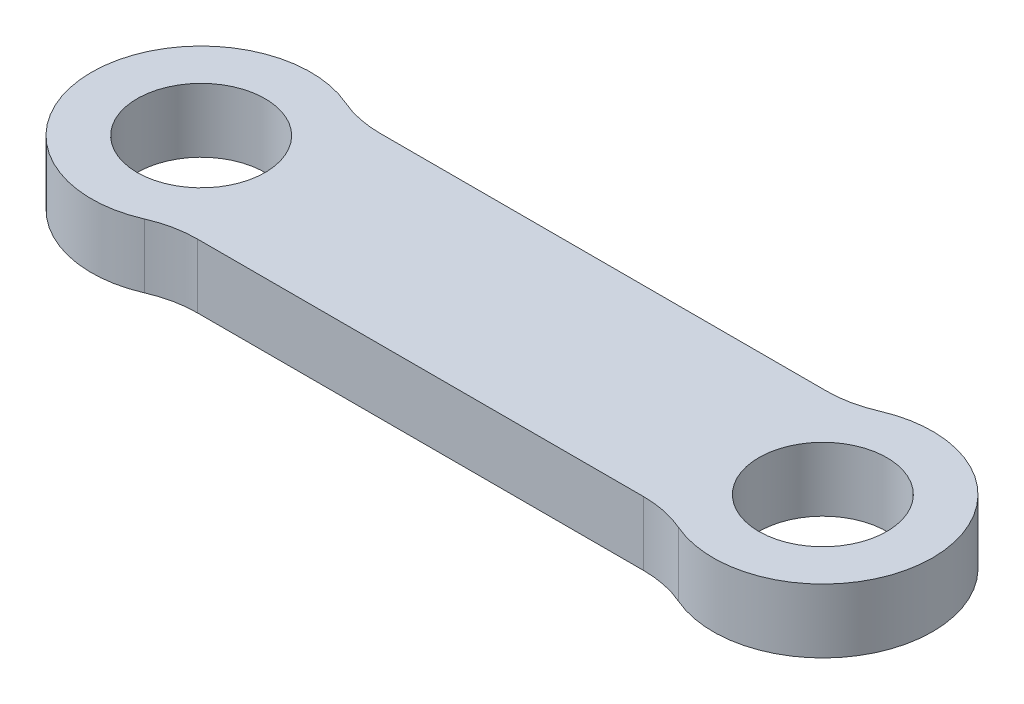
from build123d import *

# Parameters (mm, degrees)
SKETCH1_R           = 1.75
BOSS_EXTRUDE1_DEPTH = 1.75
FILLET1_R           = 3


with BuildPart() as part:
    # Sketch1 → Boss-Extrude1 (new body)
    with BuildSketch(Plane(origin=(0, 0, 0), x_dir=(1, 0, 0), z_dir=(0, 1, 0))):
        with BuildLine():
            ThreePointArc((1.658312395, 2.5), (-3, 0), (1.658312395, -2.5))
            Line((1.658312395, -2.5), (15.341687605, -2.5))
            ThreePointArc((15.341687605, -2.5), (20, 0), (15.341687605, 2.5))
            Line((15.341687605, 2.5), (1.658312395, 2.5))
        make_face()
        Circle(SKETCH1_R, mode=Mode.SUBTRACT)
        with Locations((17, 0)):
            Circle(SKETCH1_R, mode=Mode.SUBTRACT)
    extrude(amount=BOSS_EXTRUDE1_DEPTH)

    # Fillet1
    fillet1_edges = [part.edges().sort_by_distance(p)[0] for p in [
        (1.658312395, 0.875, 2.5),
        (15.341687605, 0.875, 2.5),
        (15.341687605, 0.875, -2.5),
        (1.658312395, 0.875, -2.5),
    ]]
    fillet(fillet1_edges, radius=FILLET1_R)


solid = part.part
